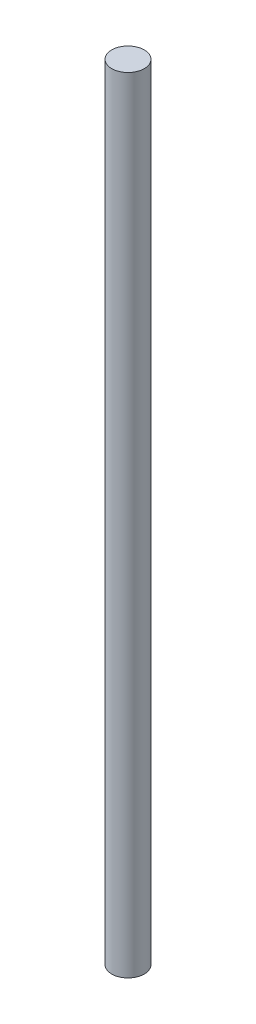
from build123d import *

# Parameters (mm, degrees)
SKETCH1_R           = 2.5
BOSS_EXTRUDE1_DEPTH = 120.65


with BuildPart() as part:
    # Sketch1 → Boss-Extrude1 (new body)
    with BuildSketch(Plane(origin=(0, 0, 0), x_dir=(1, 0, 0), z_dir=(0, 1, 0))):
        Circle(SKETCH1_R)
    extrude(amount=BOSS_EXTRUDE1_DEPTH)


solid = part.part
